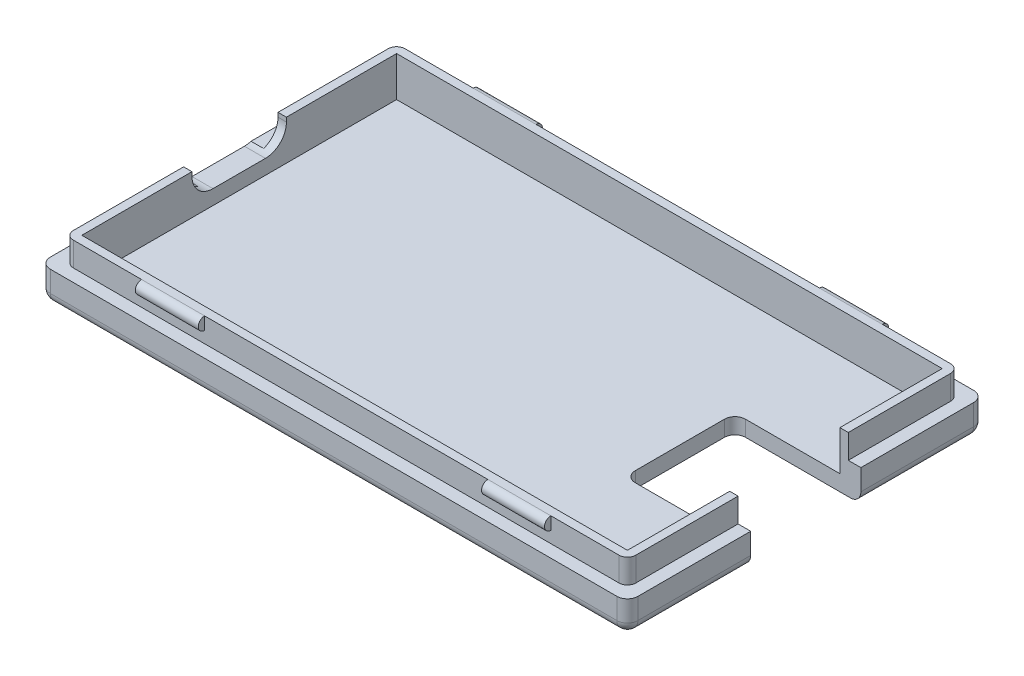
from build123d import *

# Parameters (mm, degrees)
SKETCH1_W             = 56
SKETCH1_H             = 34
BASE_DEPTH            = 1.5
SKETCH1_3_W           = 56
SKETCH1_3_H           = 34
SKETCH1_3_W_2         = 52
SKETCH1_3_H_2         = 30
BOSS_EXTRUDE2_DEPTH   = 3
SKETCH2_W             = 53.6
SKETCH2_H             = 31.6
SKETCH2_W_2           = 52
SKETCH2_H_2           = 30
WALL_DEPTH            = 2.3
SKETCH3_W             = 1.2
SKETCH3_H             = 3.75
GROOVEFOROPEN_DEPTH   = 1
LOCKPINS_START        = 13.5
SKETCH4_R             = 0.6
LOCKPINS_DEPTH        = 6
FILLETBASE_R          = 1
FILLETINNER_R         = 0.8
CUTCABLE_DEPTH        = 34.182676203
CUTFORCONNECTOR_DEPTH = 34.182676203


with BuildPart() as part:
    # Sketch1 → Base (new body)
    with BuildSketch(Plane(origin=(0, 0, 0), x_dir=(1, 0, 0), z_dir=(0, 1, 0))):
        Rectangle(SKETCH1_W, SKETCH1_H)
    extrude(amount=BASE_DEPTH)

    # Sketch1<3> → Boss-Extrude2 (add)
    with BuildSketch(Plane(origin=(0, 0, 0), x_dir=(1, 0, 0), z_dir=(0, 1, 0))):
        Rectangle(SKETCH1_3_W, SKETCH1_3_H)
        Rectangle(SKETCH1_3_W_2, SKETCH1_3_H_2, mode=Mode.SUBTRACT)
    extrude(amount=BOSS_EXTRUDE2_DEPTH)

    # Sketch2 → Wall (add)
    with BuildSketch(Plane(origin=(0, 3, 0), x_dir=(1, 0, 0), z_dir=(0, 1, 0))):
        Rectangle(SKETCH2_W, SKETCH2_H)
        Rectangle(SKETCH2_W_2, SKETCH2_H_2, mode=Mode.SUBTRACT)
    extrude(amount=WALL_DEPTH)

    # Sketch3 → GrooveForOpen (cut)
    with BuildSketch(Plane(origin=(0, 3, 0), x_dir=(1, 0, 0), z_dir=(0, 1, 0))):
        with Locations((-27.4, -8.375)):
            Rectangle(SKETCH3_W, SKETCH3_H)
        with Locations((-27.4, 8.375)):
            Rectangle(SKETCH3_W, SKETCH3_H)
    extrude(amount=-GROOVEFOROPEN_DEPTH, mode=Mode.SUBTRACT)

    # Sketch4 → LockPins (add)
    with BuildSketch(Plane(origin=(0, 0, 0), x_dir=(0, 0, -1), z_dir=(1, 0, 0)).offset(LOCKPINS_START)):
        with Locations((15.8, 4.7)):
            Circle(SKETCH4_R)
        with Locations((-15.8, 4.7)):
            Circle(SKETCH4_R)
    lockpins = extrude(amount=LOCKPINS_DEPTH)

    # LockPins2: LockPins across plane
    add(lockpins.mirror(Plane(origin=(0, 0, 0), x_dir=(0, 0, 1), z_dir=(1, 0, 0))))

    # FilletBase
    filletbase_edges = [part.edges().sort_by_distance(p)[0] for p in [
        (0, 0, 17),
        (28, 0, 0),
        (0, 0, -17),
        (-28, 0, 0),
        (28, 1.5, 17),
        (-28, 1.5, 17),
        (-28, 1.5, -17),
        (28, 1.5, -17),
    ]]
    fillet(filletbase_edges, radius=FILLETBASE_R)

    # FilletInner
    filletinner_edges = [part.edges().sort_by_distance(p)[0] for p in [
        (26.8, 4.15, 15.8),
        (-26.8, 4.15, 15.8),
        (-26.8, 4.15, -15.8),
        (26.8, 4.15, -15.8),
    ]]
    fillet(filletinner_edges, radius=FILLETINNER_R)

    # Sketch5 → CutCable (cut, through all)
    with BuildSketch(Plane(origin=(0, 0, 0), x_dir=(0, 0, -1), z_dir=(1, 0, 0))):
        with BuildLine():
            Line((-4.5, 9.622902271), (4.5, 9.622902271))
            Line((4.5, 9.622902271), (4.5, 4.9))
            ThreePointArc((4.5, 4.9), (3.914213562, 3.485786438), (2.5, 2.9))
            Line((2.5, 2.9), (-2.5, 2.9))
            ThreePointArc((-2.5, 2.9), (-3.914213562, 3.485786438), (-4.5, 4.9))
            Line((-4.5, 4.9), (-4.5, 9.622902271))
        make_face()
    extrude(amount=-CUTCABLE_DEPTH, mode=Mode.SUBTRACT)

    # Sketch7 → CutForConnector (cut, through all)
    with BuildSketch(Plane.XZ):
        with BuildLine():
            Line((32.037949749, -5.25), (17, -5.25))
            ThreePointArc((17, -5.25), (16.292893219, -4.957106781), (16, -4.25))
            Line((16, -4.25), (16, 4.25))
            ThreePointArc((16, 4.25), (16.292893219, 4.957106781), (17, 5.25))
            Line((17, 5.25), (32.037949749, 5.25))
            Line((32.037949749, 5.25), (32.037949749, -5.25))
        make_face()
    extrude(amount=-CUTFORCONNECTOR_DEPTH, mode=Mode.SUBTRACT)


solid = part.part
